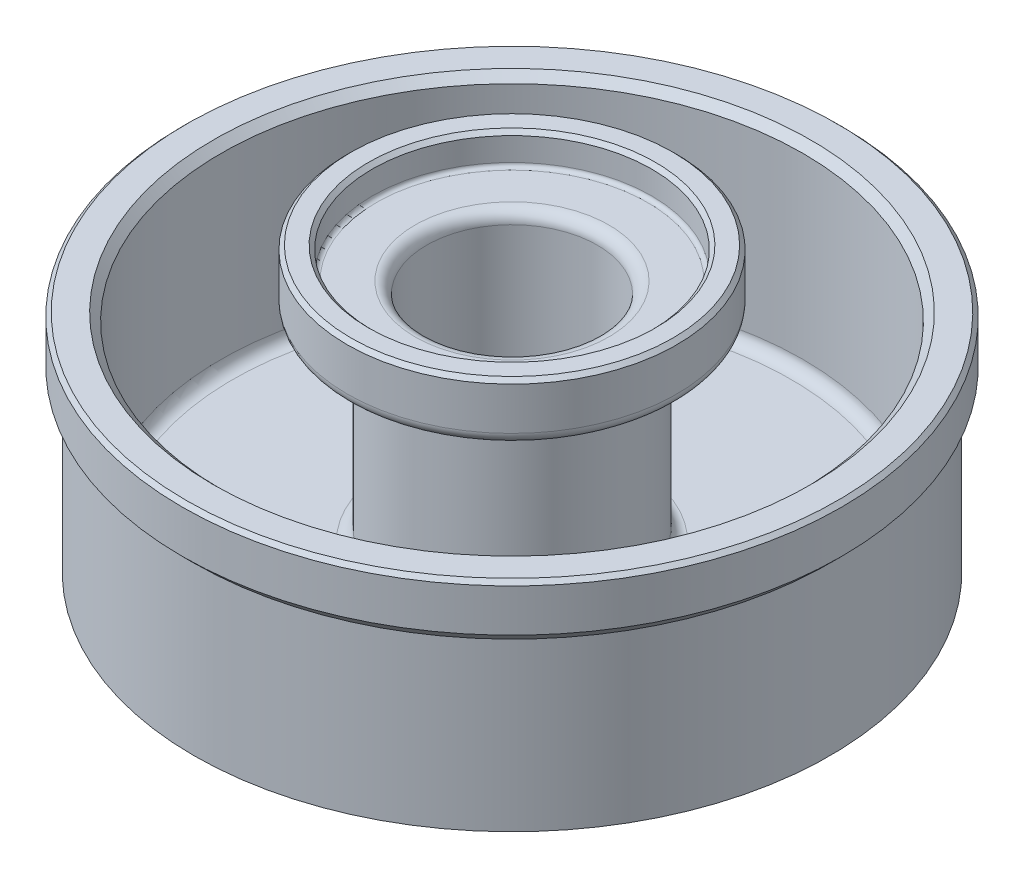
from build123d import *

# Parameters (mm, degrees)
SKETCH2_R           = 82
BOSS_EXTRUDE1_DEPTH = 43
SKETCH3_R           = 85
BOSS_EXTRUDE2_DEPTH = 15
SKETCH4_R           = 75
CUT_EXTRUDE1_DEPTH  = 51
SKETCH5_R           = 29
BOSS_EXTRUDE3_DEPTH = 51
SKETCH6_R           = 42.5
BOSS_EXTRUDE4_DEPTH = 15
SKETCH7_R           = 36
CUT_EXTRUDE6_DEPTH  = 8
SKETCH7_5_R         = 22
CUT_EXTRUDE7_DEPTH  = 141.637832748
CHAMFER1_SIZE       = 1
CHAMFER2_SIZE       = 2
FILLET1_R           = 3
CHAMFER3_SIZE       = 3
FILLET2_R           = 1


with BuildPart() as part:
    # Sketch2 → Boss-Extrude1 (new body)
    with BuildSketch(Plane(origin=(0, 0, 0), x_dir=(1, 0, 0), z_dir=(0, 1, 0))):
        with Locations(Location((0, 0, 0), (0, 0, 270))):
            Circle(SKETCH2_R)
    extrude(amount=BOSS_EXTRUDE1_DEPTH)

    # Sketch3 → Boss-Extrude2 (add)
    with BuildSketch(Plane(origin=(0, 43, 0), x_dir=(1, 0, 0), z_dir=(0, 1, 0))):
        with Locations(Location((0, 0, 0), (0, 0, 270))):
            Circle(SKETCH3_R)
    extrude(amount=BOSS_EXTRUDE2_DEPTH)

    # Sketch4 → Cut-Extrude1 (cut)
    with BuildSketch(Plane(origin=(0, 58, 0), x_dir=(1, 0, 0), z_dir=(0, 1, 0))):
        with Locations(Location((0, 0, 0), (0, 0, 270))):
            Circle(SKETCH4_R)
    extrude(amount=-CUT_EXTRUDE1_DEPTH, mode=Mode.SUBTRACT)

    # Sketch5 → Boss-Extrude3 (add)
    with BuildSketch(Plane(origin=(0, 7, 0), x_dir=(1, 0, 0), z_dir=(0, 1, 0))):
        with Locations(Location((0, 0, 0), (0, 0, 270))):
            Circle(SKETCH5_R)
    extrude(amount=BOSS_EXTRUDE3_DEPTH)

    # Sketch6 → Boss-Extrude4 (add)
    with BuildSketch(Plane(origin=(0, 58, 0), x_dir=(1, 0, 0), z_dir=(0, 1, 0))):
        with Locations(Location((0, 0, 0), (0, 0, 270))):
            Circle(SKETCH6_R)
    extrude(amount=BOSS_EXTRUDE4_DEPTH)

    # Sketch7 → Cut-Extrude6 (cut)
    with BuildSketch(Plane(origin=(0, 73, 0), x_dir=(1, 0, 0), z_dir=(0, 1, 0))):
        with Locations(Location((0, 0, 0), (0, 0, 270))):
            Circle(SKETCH7_R)
    extrude(amount=-CUT_EXTRUDE6_DEPTH, mode=Mode.SUBTRACT)

    # Sketch7<5> → Cut-Extrude7 (cut, through all)
    with BuildSketch(Plane(origin=(0, 73, 0), x_dir=(1, 0, 0), z_dir=(0, 1, 0))):
        with Locations(Location((0, 0, 0), (0, 0, 270))):
            Circle(SKETCH7_5_R)
    extrude(amount=-CUT_EXTRUDE7_DEPTH, mode=Mode.SUBTRACT)

    # Chamfer1
    chamfer1_edges = [part.edges().sort_by_distance(p)[0] for p in [
        (0, 73, -42.5),
        (0, 73, -36),
        (0, 58, -85),
    ]]
    chamfer(chamfer1_edges, length=CHAMFER1_SIZE)

    # Chamfer2
    chamfer2_edges = [part.edges().sort_by_distance(p)[0] for p in [
        (0, 58, -75),
    ]]
    chamfer(chamfer2_edges, length=CHAMFER2_SIZE)

    # Fillet1
    fillet1_edges = [part.edges().sort_by_distance(p)[0] for p in [
        (0, 7, -75),
        (0, 7, -29),
        (0, 58, -29),
        (0, 58, -42.5),
        (0, 65, -22),
        (0, 0, -22),
    ]]
    fillet(fillet1_edges, radius=FILLET1_R)

    # Chamfer3
    chamfer3_edges = [part.edges().sort_by_distance(p)[0] for p in [
        (0, 43, -85),
    ]]
    chamfer(chamfer3_edges, length=CHAMFER3_SIZE - 0.0001)  # a hair under: the kernel refuses the full size

    # Fillet2
    fillet2_edges = [part.edges().sort_by_distance(p)[0] for p in [
        (0, 65, -36),
    ]]
    fillet(fillet2_edges, radius=FILLET2_R)


solid = part.part
